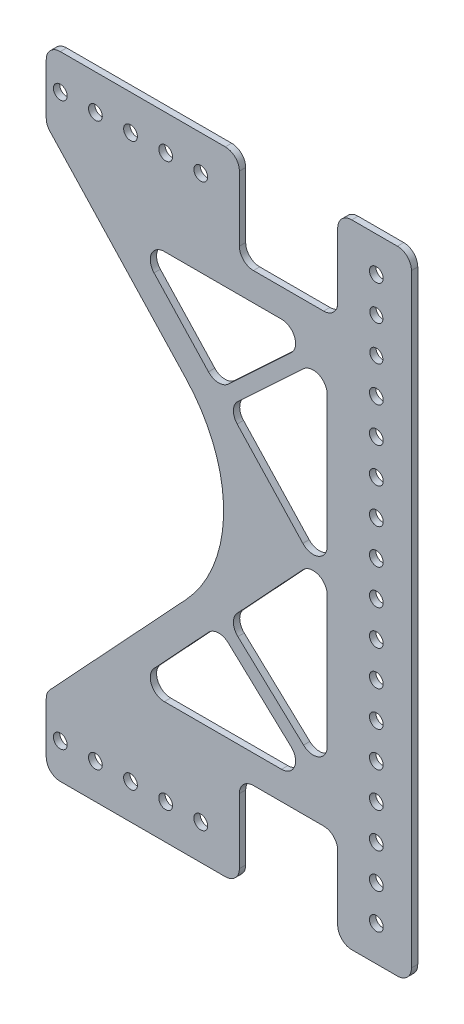
from build123d import *

# Parameters (mm, degrees)
SKETCH1_R           = 2.4892
SKETCH1_R_2         = 2.37186857
BOSS_EXTRUDE2_DEPTH = 2.286


with BuildPart() as part:
    # Sketch1 → Boss-Extrude2 (new body)
    with BuildSketch(Plane.XY):
        with BuildLine():
            ThreePointArc((70.48759274, 893.417727162), (68.999695188, 897.009829611), (65.40759274, 898.497727162))
            Line((65.40759274, 898.497727162), (48.89759274, 898.497727162))
            ThreePointArc((48.89759274, 898.497727162), (45.305490291, 897.009829611), (43.81759274, 893.417727162))
            Line((43.81759274, 893.417727162), (43.81759274, 869.922727162))
            ThreePointArc((43.81759274, 869.922727162), (42.329695188, 866.330624714), (38.73759274, 864.842727162))
            Line((38.73759274, 864.842727162), (13.33759274, 864.842727162))
            ThreePointArc((13.33759274, 864.842727162), (9.745490291, 866.330624714), (8.25759274, 869.922727162))
            Line((8.25759274, 869.922727162), (8.25759274, 893.417727162))
            ThreePointArc((8.25759274, 893.417727162), (6.769695188, 897.009829611), (3.17759274, 898.497727162))
            Line((3.17759274, 898.497727162), (-56.51240726, 898.497727162))
            ThreePointArc((-56.51240726, 898.497727162), (-60.104509709, 897.009829611), (-61.59240726, 893.417727162))
            Line((-61.59240726, 893.417727162), (-61.59240726, 875.096507696))
            ThreePointArc((-61.59240726, 875.096507696), (-61.239653123, 873.236522064), (-60.230381059, 871.634850458))
            Line((-60.230381059, 871.634850458), (-11.051271068, 818.81429954))
            ThreePointArc((-11.051271068, 818.81429954), (2.568990945, 784.197727162), (-11.051271068, 749.581154784))
            Line((-11.051271068, 749.581154784), (-60.230381059, 696.760603866))
            ThreePointArc((-60.230381059, 696.760603866), (-61.239653123, 695.15893226), (-61.59240726, 693.298946628))
            Line((-61.59240726, 693.298946628), (-61.59240726, 674.977727162))
            ThreePointArc((-61.59240726, 674.977727162), (-60.104509709, 671.385624714), (-56.51240726, 669.897727162))
            Line((-56.51240726, 669.897727162), (3.17759274, 669.897727162))
            ThreePointArc((3.17759274, 669.897727162), (6.769695188, 671.385624714), (8.25759274, 674.977727162))
            Line((8.25759274, 674.977727162), (8.25759274, 698.472727162))
            ThreePointArc((8.25759274, 698.472727162), (9.745490291, 702.064829611), (13.33759274, 703.552727162))
            Line((13.33759274, 703.552727162), (38.73759274, 703.552727162))
            ThreePointArc((38.73759274, 703.552727162), (42.329695188, 702.064829611), (43.81759274, 698.472727162))
            Line((43.81759274, 698.472727162), (43.81759274, 674.977727162))
            ThreePointArc((43.81759274, 674.977727162), (45.305490291, 671.385624714), (48.89759274, 669.897727162))
            Line((48.89759274, 669.897727162), (65.40759274, 669.897727162))
            ThreePointArc((65.40759274, 669.897727162), (68.999695188, 671.385624714), (70.48759274, 674.977727162))
            Line((70.48759274, 674.977727162), (70.48759274, 784.197727162))
            Line((70.48759274, 784.197727162), (70.48759274, 893.417727162))
        make_face()
        with Locations((-56.51240726, 682.597727162)):
            Circle(SKETCH1_R, mode=Mode.SUBTRACT)
        with Locations((-43.81240726, 682.597727162)):
            Circle(SKETCH1_R, mode=Mode.SUBTRACT)
        with Locations((-31.11240726, 682.597727162)):
            Circle(SKETCH1_R, mode=Mode.SUBTRACT)
        with Locations((-18.41240726, 682.597727162)):
            Circle(SKETCH1_R, mode=Mode.SUBTRACT)
        with Locations((-5.71240726, 682.597727162)):
            Circle(SKETCH1_R, mode=Mode.SUBTRACT)
        with BuildLine():
            Line((4.254307315, 743.655247282), (26.964490273, 722.510700961))
            ThreePointArc((26.964490273, 722.510700961), (28.230078898, 716.93274153), (23.502833035, 713.712727162))
            Line((23.502833035, 713.712727162), (-18.894194364, 713.712727162))
            ThreePointArc((-18.894194364, 713.712727162), (-23.552070423, 716.765268009), (-22.612168162, 722.2543844))
            Line((-22.612168162, 722.2543844), (-2.925323721, 743.398930721))
            ThreePointArc((-2.925323721, 743.398930721), (0.611406899, 745.014039275), (4.254307315, 743.655247282))
        make_face(mode=Mode.SUBTRACT)
        with Locations((57.78759274, 682.597727162)):
            Circle(SKETCH1_R, mode=Mode.SUBTRACT)
        with Locations((57.78759274, 695.297727162)):
            Circle(SKETCH1_R, mode=Mode.SUBTRACT)
        with Locations((57.78759274, 707.997727162)):
            Circle(SKETCH1_R, mode=Mode.SUBTRACT)
        with Locations((57.78759274, 720.697727162)):
            Circle(SKETCH1_R, mode=Mode.SUBTRACT)
        with BuildLine():
            ThreePointArc((7.715964553, 747.37322108), (6.100855998, 750.909951701), (7.459647992, 754.552852117))
            Line((7.459647992, 754.552852117), (31.209618941, 780.061376977))
            ThreePointArc((31.209618941, 780.061376977), (36.787578372, 781.326965602), (40.00759274, 776.599719739))
            Line((40.00759274, 776.599719739), (40.00759274, 728.978543396))
            ThreePointArc((40.00759274, 728.978543396), (36.955051892, 724.320667337), (31.465935502, 725.260569598))
            Line((31.465935502, 725.260569598), (7.715964553, 747.37322108))
        make_face(mode=Mode.SUBTRACT)
        with Locations((57.78759274, 733.397727162)):
            Circle(SKETCH1_R, mode=Mode.SUBTRACT)
        with Locations((57.78759274, 746.097727162)):
            Circle(SKETCH1_R, mode=Mode.SUBTRACT)
        with Locations((57.78759274, 758.797727162)):
            Circle(SKETCH1_R, mode=Mode.SUBTRACT)
        with Locations((57.78759274, 771.497727162)):
            Circle(SKETCH1_R, mode=Mode.SUBTRACT)
        with Locations((57.78759274, 784.197727162)):
            Circle(SKETCH1_R, mode=Mode.SUBTRACT)
        with BuildLine():
            Line((-2.925323721, 824.996523604), (-22.612168162, 846.141069924))
            ThreePointArc((-22.612168162, 846.141069924), (-23.552070423, 851.630186315), (-18.894194364, 854.682727162))
            Line((-18.894194364, 854.682727162), (23.502833035, 854.682727162))
            ThreePointArc((23.502833035, 854.682727162), (28.230078898, 851.462712794), (26.964490273, 845.884753363))
            Line((26.964490273, 845.884753363), (4.254307315, 824.740207043))
            ThreePointArc((4.254307315, 824.740207043), (0.611406899, 823.381415049), (-2.925323721, 824.996523604))
        make_face(mode=Mode.SUBTRACT)
        with Locations((-56.51240726, 885.797727162)):
            Circle(SKETCH1_R, mode=Mode.SUBTRACT)
        with Locations((-43.81240726, 885.797727162)):
            Circle(SKETCH1_R, mode=Mode.SUBTRACT)
        with Locations((-31.11240726, 885.797727162)):
            Circle(SKETCH1_R, mode=Mode.SUBTRACT)
        with Locations((-18.41240726, 885.797727162)):
            Circle(SKETCH1_R, mode=Mode.SUBTRACT)
        with Locations((-5.71240726, 885.797727162)):
            Circle(SKETCH1_R, mode=Mode.SUBTRACT)
        with BuildLine():
            Line((40.00759274, 839.416910928), (40.00759274, 791.795734585))
            ThreePointArc((40.00759274, 791.795734585), (36.787578372, 787.068488722), (31.209618941, 788.334077347))
            Line((31.209618941, 788.334077347), (7.459647992, 813.842602208))
            ThreePointArc((7.459647992, 813.842602208), (6.100855998, 817.485502624), (7.715964553, 821.022233244))
            Line((7.715964553, 821.022233244), (31.465935502, 843.134884727))
            ThreePointArc((31.465935502, 843.134884727), (36.955051892, 844.074786987), (40.00759274, 839.416910928))
        make_face(mode=Mode.SUBTRACT)
        with Locations((57.78759274, 796.897727162)):
            Circle(SKETCH1_R, mode=Mode.SUBTRACT)
        with Locations((57.78759274, 809.597727162)):
            Circle(SKETCH1_R, mode=Mode.SUBTRACT)
        with Locations((57.78759274, 822.297727162)):
            Circle(SKETCH1_R, mode=Mode.SUBTRACT)
        with Locations((57.78759274, 834.997727162)):
            Circle(SKETCH1_R, mode=Mode.SUBTRACT)
        with Locations((57.78759274, 847.697727162)):
            Circle(SKETCH1_R, mode=Mode.SUBTRACT)
        with Locations((57.78759274, 860.397727162)):
            Circle(SKETCH1_R_2, mode=Mode.SUBTRACT)
        with Locations((57.78759274, 873.097727162)):
            Circle(SKETCH1_R_2, mode=Mode.SUBTRACT)
        with Locations((57.78759274, 885.797727162)):
            Circle(SKETCH1_R, mode=Mode.SUBTRACT)
    extrude(amount=BOSS_EXTRUDE2_DEPTH)


solid = part.part
